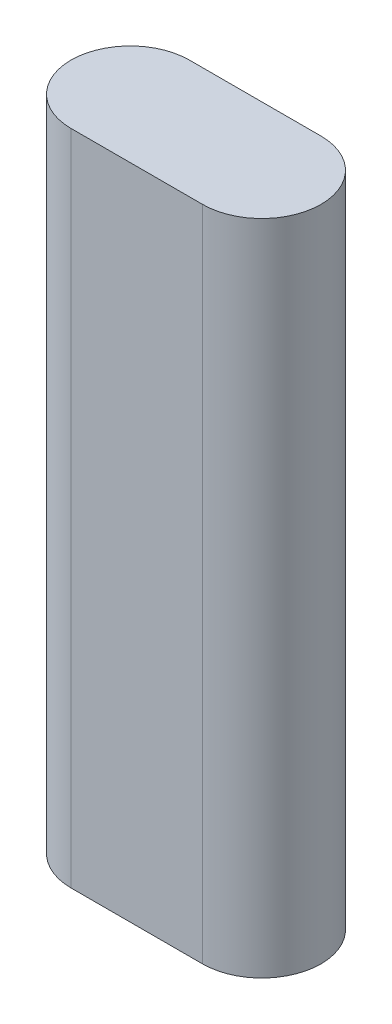
from build123d import *

# Parameters (mm, degrees)
BOSS_EXTRUDE1_DEPTH = 2500


with BuildPart() as part:
    # Sketch1 → Boss-Extrude1 (new body)
    with BuildSketch(Plane(origin=(0, 0, 0), x_dir=(1, 0, 0), z_dir=(0, 1, 0))):
        with BuildLine():
            Line((250, -225), (-250, -225))
            ThreePointArc((-250, -225), (-475, 0), (-250, 225))
            Line((-250, 225), (250, 225))
            ThreePointArc((250, 225), (475, 0), (250, -225))
        make_face()
    extrude(amount=BOSS_EXTRUDE1_DEPTH)


solid = part.part
